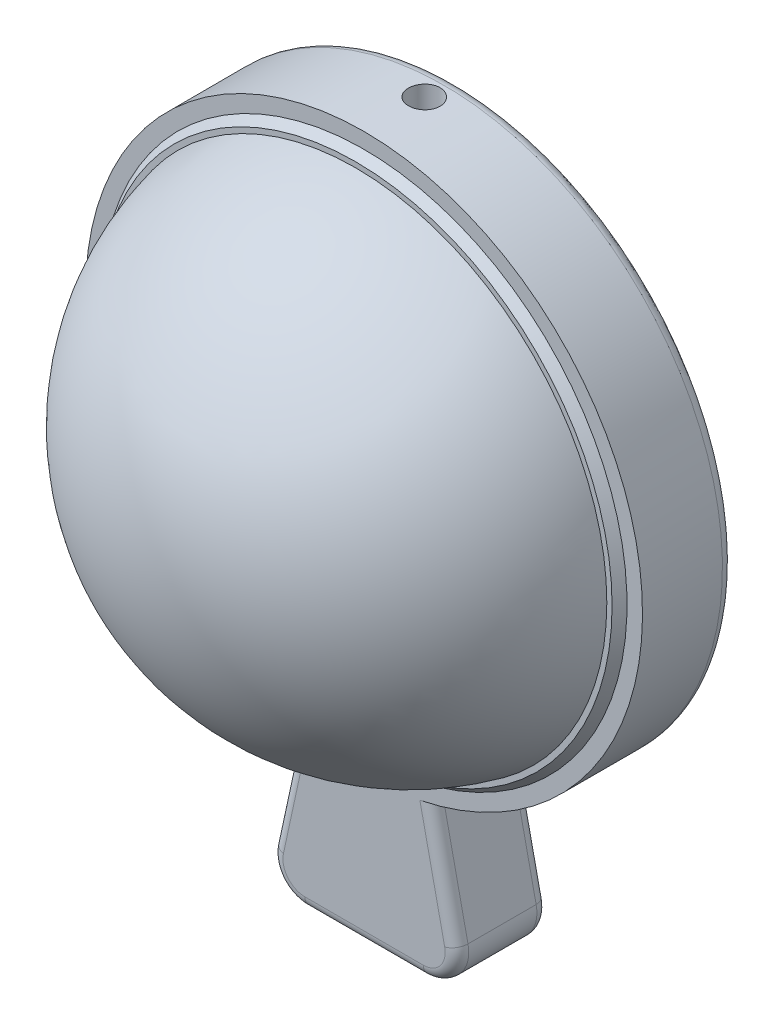
from build123d import *

# Parameters (mm, degrees)
BOSS_EXTRUDE1_START     = -13.843
BOSS_EXTRUDE1_DEPTH     = 13.843
CUT_EXTRUDE1_DEPTH      = 118.939907135
CUT_EXTRUDE1_DEPTH_BACK = 118.939907135
SKETCH2_R               = 2.38125
FILLET1_R               = 5.08
FILLET2_R               = 1.778


# Read off the part's stored shape, not the designer's step: Shell1
with BuildPart() as part:
    # Sketch1 → Revolve1 (revolve)
    with BuildSketch(Plane(origin=(0, 0, 0), x_dir=(1, 0, 0), z_dir=(0, 1, 0)), mode=Mode.PRIVATE) as revolve1_sk:
        with BuildLine():
            Line((-11.76329111, 21.185724662), (-11.76329111, 7.342724662))
            Line((-11.76329111, 7.342724662), (-14.10009111, 7.342724662))
            Line((-14.10009111, 7.342724662), (-15.08434111, 6.072724662))
            Line((-15.08434111, 6.072724662), (-15.87809111, 6.072724662))
            ThreePointArc((-15.87809111, 6.072724662), (-29.426153143, -15.927440725), (-53.78759111, -24.534275338))
            Line((-53.78759111, -24.534275338), (-53.78759111, 21.185724662))
            Line((-53.78759111, 21.185724662), (-11.76329111, 21.185724662))
        make_face()
    revolve(revolve1_sk.sketch.rotate(Axis((-53.78759111, 0, -21.185724662), (0, 0, 1)), 180), axis=Axis((-53.78759111, 0, -21.185724662), (0, 0, 1)))

    # Shell1 outline → Shell1 (revolve, cut)
    with BuildSketch(Plane(origin=(-53.78759111, 0, 0), x_dir=(1, 0, 0), z_dir=(0, -1, 0))):
        with BuildLine():
            Line((36.368872083, -10.835224662), (33.846691352, -10.835224695))
            ThreePointArc((33.846691352, -10.835224695), (22.816589176, 10.985307164), (0, 19.771775338))
            Line((0, 19.771775338), (0, -21.185724662))
            Line((0, -21.185724662), (37.2618, -21.185724662))
            Line((37.2618, -21.185724662), (37.2618, -11.987389716))
            Line((37.2618, -11.987389716), (36.368872083, -10.835224662))
        make_face()
    revolve(axis=Axis((-53.78759111, 0, 0), (0, 0, 1)), mode=Mode.SUBTRACT)

    # Sketch5 → Boss-Extrude1 (add)
    with BuildSketch(Plane(origin=(0, 0, -21.185724662), x_dir=(-1, 0, 0), z_dir=(0, 0, -1)).offset(BOSS_EXTRUDE1_START)):
        with BuildLine():
            Line((53.78759111, -64.2493), (53.78759111, -42.0243))
            ThreePointArc((53.78759111, -42.0243), (48.669492024, -41.711471471), (43.62759111, -40.777643268))
            Line((43.62759111, -40.777643268), (38.54759111, -64.2493))
            Line((38.54759111, -64.2493), (53.78759111, -64.2493))
        make_face()
        with BuildLine():
            ThreePointArc((63.94759111, -40.777643268), (58.905690196, -41.711471471), (53.78759111, -42.0243))
            Line((53.78759111, -42.0243), (53.78759111, -64.2493))
            Line((53.78759111, -64.2493), (69.02759111, -64.2493))
            Line((69.02759111, -64.2493), (63.94759111, -40.777643268))
        make_face()
    extrude(amount=BOSS_EXTRUDE1_DEPTH)

    # Sketch2 → Cut-Extrude1 (cut, two sides: drawn at the far end of the back side and taken through both)
    with BuildSketch(Plane(origin=(0, 0, 0), x_dir=(1, 0, 0), z_dir=(0, 1, 0)).offset(-CUT_EXTRUDE1_DEPTH_BACK)):
        with Locations(Location((-53.78759111, 16.423224662, 0), (0, 0, 270))):
            Circle(SKETCH2_R)
    extrude(amount=CUT_EXTRUDE1_DEPTH + CUT_EXTRUDE1_DEPTH_BACK, mode=Mode.SUBTRACT)

    # Fillet1
    fillet1_edges = [part.edges().sort_by_distance(p)[0] for p in [
        (-69.02759111, -64.2493, -14.264224662),
        (-38.54759111, -64.2493, -14.264224662),
    ]]
    fillet(fillet1_edges, radius=FILLET1_R)

    # Fillet2
    fillet2_edges = [part.edges().sort_by_distance(p)[0] for p in [
        (-91.04939111, 0, -21.185724662),
        (-53.78759111, 42.0243, -21.185724662),
        (-65.82156825, -49.436176368, -21.185724662),
        (-41.75361397, -49.436176368, -21.185724662),
        (-41.75361397, -49.436176368, -7.342724662),
        (-53.78759111, -64.2493, -21.185724662),
        (-66.684317939, -62.358930081, -21.185724662),
        (-40.89086428, -62.358930081, -21.185724662),
        (-53.78759111, -64.2493, -7.342724662),
        (-65.82156825, -49.436176368, -7.342724662),
        (-66.684317939, -62.358930081, -7.342724662),
        (-40.89086428, -62.358930081, -7.342724662),
    ]]
    fillet(fillet2_edges, radius=FILLET2_R)


solid = part.part
